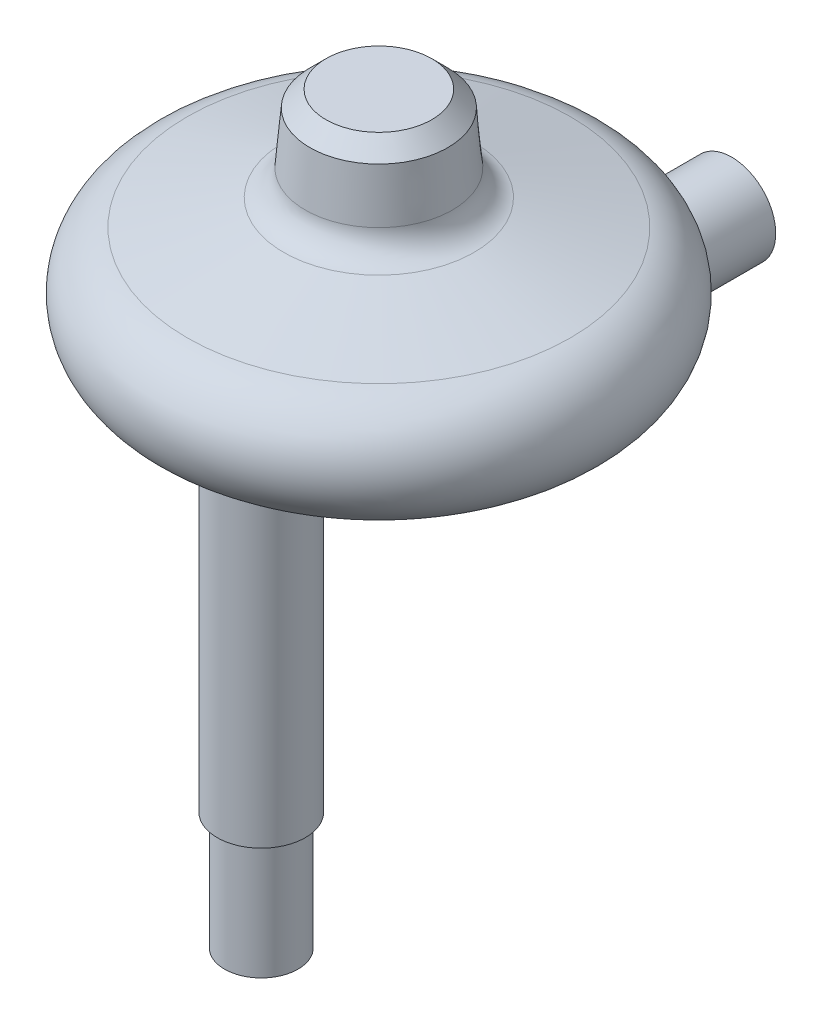
from build123d import *

# Parameters (mm, degrees)
SKETCH2_R           = 9.525
BOSS_EXTRUDE1_DEPTH = 25.4
BOSS_EXTRUDE1_DRAFT = -5
FILLET1_R           = 3.175
SKETCH3_R           = 4.7625
BOSS_EXTRUDE2_DEPTH = 35.875
FILLET2_R           = 3.175
BOSS_EXTRUDE3_DEPTH = 19.05
FILLET4_R           = 1.5875
FILLET8_R           = 1.5875
CHAMFER1_SIZE       = 1.5875
CHAMFER1_SIZE2      = 1.746349802
SKETCH5_R           = 4.7625
BOSS_EXTRUDE4_DEPTH = 12.7
SKETCH6_R           = 3.96875
BOSS_EXTRUDE5_DEPTH = 12.7


with BuildPart() as part:
    # Sketch1 → Base-Revolve (revolve)
    with BuildSketch(Plane.XY):
        with BuildLine():
            Line((0, 0), (19.05, 0))
            ThreePointArc((19.05, 0), (25.34567487, 5.521158679), (20.693500936, 12.483628997))
            Line((20.693500936, 12.483628997), (0, 18.028435861))
            Line((0, 18.028435861), (0, 0))
        make_face()
    revolve(axis=Axis((0, 0, 0), (0, 1, 0)))


with BuildPart() as boss_extrude1_tool:
    # Sketch2 → Boss-Extrude1 (with draft: the straight prism first)
    with BuildSketch(Plane.XZ):
        Circle(SKETCH2_R)
    extrude(amount=-BOSS_EXTRUDE1_DEPTH)
    # Boss-Extrude1: the draft: its side faces are tilted about the plane it starts from
    boss_extrude1_sides = [boss_extrude1_tool.faces().sort_by_distance(p)[0] for p in [
        (-9.525, 12.7, 0),
    ]]
    draft(boss_extrude1_sides, Plane.XZ, BOSS_EXTRUDE1_DRAFT)


with BuildPart() as part_1:
    add(part.part)

    # Boss-Extrude1: add boss_extrude1_tool
    add(boss_extrude1_tool.part)

    # Fillet1
    fillet1_edges = [part_1.edges().sort_by_distance(p)[0] for p in [
        (-8.138503239, 15.847730491, 0),
    ]]
    fillet(fillet1_edges, radius=FILLET1_R)

    # Sketch3 → Boss-Extrude2 (add)
    with BuildSketch(Plane.XZ):
        with Locations((0, 12.7)):
            Circle(SKETCH3_R)
    extrude(amount=BOSS_EXTRUDE2_DEPTH)

    # Fillet2
    fillet2_edges = [part_1.edges().sort_by_distance(p)[0] for p in [
        (-4.7625, 0, 12.7),
    ]]
    fillet(fillet2_edges, radius=FILLET2_R)

    # Sketch4 → Boss-Extrude3 (add)
    with BuildSketch(Plane.XY.offset(-6.35)):
        with BuildLine():
            Line((-4.7625, 1.5875), (4.7625, 1.5875))
            Line((4.7625, 1.5875), (4.7625, -4.7625))
            ThreePointArc((4.7625, -4.7625), (0, -9.525), (-4.7625, -4.7625))
            Line((-4.7625, -4.7625), (-4.7625, 1.5875))
        make_face()
    extrude(amount=-BOSS_EXTRUDE3_DEPTH)

    # Fillet4
    fillet4_edges = [part_1.edges().sort_by_distance(p)[0] for p in [
        (4.7625, -2.38125, -6.35),
        (0, -9.525, -6.35),
        (-4.7625, -2.38125, -6.35),
    ]]
    fillet(fillet4_edges, radius=FILLET4_R)

    # Fillet8
    fillet8_edges = [part_1.edges().sort_by_distance(p)[0] for p in [
        (-20.693500936, 12.483628997, 0),
        (4.7625, 0, -13.191291593),
        (4.297532015, 0, -6.814967985),
        (0, 0, -6.35),
        (-4.297532015, 0, -6.814967985),
        (-20.693500936, 12.483628997, 0),
        (-4.7625, 0, -13.191291593),
    ]]
    fillet(fillet8_edges, radius=FILLET8_R)

    # Chamfer1
    chamfer1_edges = [part_1.edges().sort_by_distance(p)[0] for p in [
        (-7.302787946, 25.4, 0),
    ]]
    chamfer1_side = [part_1.faces().sort_by_distance(p)[0] for p in [
        (0, 25.4, 0),
    ]]
    chamfer(chamfer1_edges, length=CHAMFER1_SIZE, length2=CHAMFER1_SIZE2, reference=chamfer1_side[0])

    # Sketch5 → Boss-Extrude4 (add)
    with BuildSketch(Plane(origin=(0, 0, -25.4), x_dir=(-1, 0, 0), z_dir=(0, 0, -1))):
        with Locations((0, -4.7625)):
            Circle(SKETCH5_R)
    extrude(amount=BOSS_EXTRUDE4_DEPTH)

    # Sketch6 → Boss-Extrude5 (add)
    with BuildSketch(Plane.XZ.offset(35.875)):
        with Locations((0, 12.7)):
            Circle(SKETCH6_R)
    extrude(amount=BOSS_EXTRUDE5_DEPTH)


solid = part_1.part
